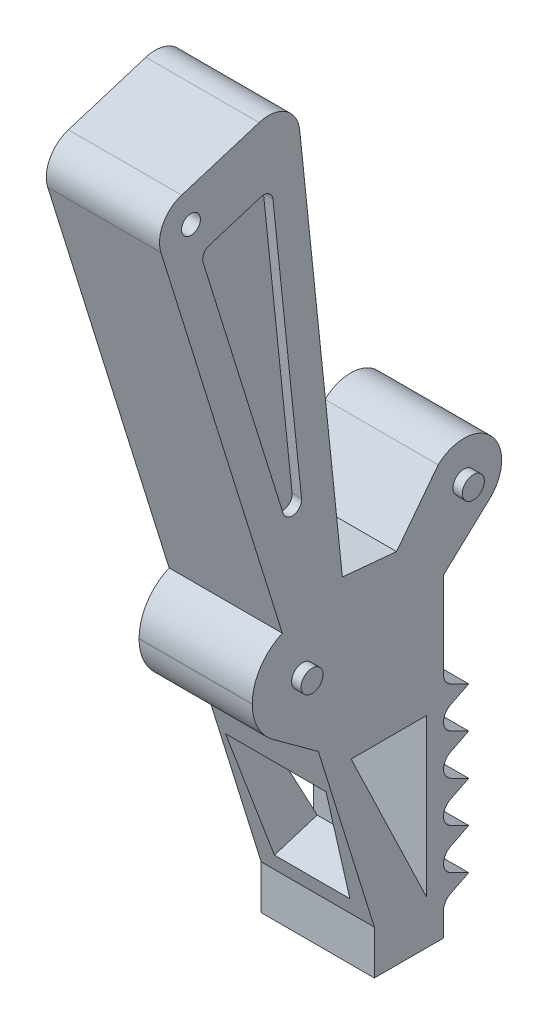
from build123d import *

# Parameters (mm, degrees)
BOSS_EXTRUDE1_DEPTH    = 9
CUT_EXTRUDE1_DEPTH     = 25
BOSS_EXTRUDE2_DEPTH    = 18
FILLET1_R              = 2
LPATTERN1_COUNT        = 5
LPATTERN1_PITCH        = 6.5
FILLET1_OF_LPATTERN1_R = 2
FILLET2_R              = 8
FILLET3_R              = 5
SKETCH4_R              = 1.5
CUT_EXTRUDE2_DEPTH     = 25
CUT_EXTRUDE3_DEPTH     = 8
SKETCH6_R              = 1.75
BOSS_EXTRUDE3_DEPTH    = 1.5
SKETCH7_R              = 1.75
BOSS_EXTRUDE4_DEPTH    = 1.5
CUT_EXTRUDE4_DEPTH     = 1.5


with BuildPart() as part:
    # Sketch1 → Boss-Extrude1 (new, symmetric)
    with BuildSketch(Plane(origin=(0, 0, 0), x_dir=(0, 0, -1), z_dir=(1, 0, 0))):
        Polygon((78.599259113, -4.792439116), (85.922516335, 2.017105925), (77.751062285, 10.805014591), (71.129492545, 2.15772468), (62.512029777, 2.969258034), (52.963024241, 0), (48.188521473, -1.484629017), (48.188521473, -11.484629017), (58.691485012, -19.145422508), (67.599259113, -47.792439116), (67.599259113, -54.792439116), (78.599259113, -54.792439116), align=None)
        Polygon((62.512029777, 2.969258034), (52.963024241, 0), (32.178218004, 66.843038752), (55.09583129, 73.969258034), align=None)
        with BuildLine():
            Line((85.922516335, 2.017105925), (77.751062285, 10.805014591))
            ThreePointArc((77.751062285, 10.805014591), (86.230743643, 10.496787283), (85.922516335, 2.017105925))
        make_face()
    extrude(amount=BOSS_EXTRUDE1_DEPTH, both=True)

    # Sketch2 → Cut-Extrude1 (cut)
    with BuildSketch(Plane(origin=(9, 0, 0), x_dir=(0, 0, -1), z_dir=(1, 0, 0))):
        Polygon((75.899259113, -47.792439116), (75.899259113, -22.792439116), (63.899259113, -22.792439116), align=None)
    extrude(amount=-CUT_EXTRUDE1_DEPTH, mode=Mode.SUBTRACT)

    # Sketch3 → Boss-Extrude2 (add)
    with BuildSketch(Plane(origin=(9, 0, 0), x_dir=(0, 0, -1), z_dir=(1, 0, 0))):
        Polygon((78.599259113, -47.792439116), (78.599259113, -49.792439116), (82.599259113, -47.792439116), align=None)
        Polygon((78.599259113, -45.792439116), (78.599259113, -47.792439116), (82.599259113, -47.792439116), align=None)
    boss_extrude2 = extrude(amount=-BOSS_EXTRUDE2_DEPTH)

    # Fillet1
    fillet1_edges = [part.edges().sort_by_distance(p)[0] for p in [
        (0, -49.792439116, -78.599259113),
        (0, -45.792439116, -78.599259113),
    ]]
    fillet(fillet1_edges, radius=FILLET1_R)

    # LPattern1: Boss-Extrude2 ×5
    with Locations(*[(0, i * LPATTERN1_PITCH, 0) for i in range(1, LPATTERN1_COUNT)]):
        add(boss_extrude2)

    # Fillet1 of LPattern1
    fillet1_of_lpattern1_edges = [part.edges().sort_by_distance(p)[0] for p in [
        (0, -43.292439116, -78.599259113),
        (0, -39.292439116, -78.599259113),
        (0, -36.792439116, -78.599259113),
        (0, -32.792439116, -78.599259113),
        (0, -30.292439116, -78.599259113),
        (0, -26.292439116, -78.599259113),
        (0, -23.792439116, -78.599259113),
        (0, -19.792439116, -78.599259113),
    ]]
    fillet(fillet1_of_lpattern1_edges, radius=FILLET1_OF_LPATTERN1_R)

    # Fillet2
    # the kernel refuses this fillet: 8 mm, written as the material it takes off along each edge
    with BuildSketch(Plane(origin=(-19.167047595, -11.484629017, -48.188521473), x_dir=(0, -0.5892918069975562, -0.8079202721838058), z_dir=(1, 0, 0))) as fillet2_piece_1:
        with BuildLine():
            CenterArc((FILLET2_R * 0.508352379737, FILLET2_R), FILLET2_R, 216.10676877, 53.89323123)
            Line((-FILLET2_R * 0.299567892447, FILLET2_R * 0.410708193002), (-FILLET2_R * 0.31572629789, FILLET2_R * 0.398922356862))
            Line((-FILLET2_R * 0.31572629789, FILLET2_R * 0.398922356862), (-FILLET2_R * 0.0101670475947, -FILLET2_R * 0.02))
            Line((-FILLET2_R * 0.0101670475947, -FILLET2_R * 0.02), (FILLET2_R * 0.508352379737, -FILLET2_R * 0.02))
            Line((FILLET2_R * 0.508352379737, -FILLET2_R * 0.02), (FILLET2_R * 0.508352379737, 0))
        make_face()
    extrude(amount=38.334095189, mode=Mode.SUBTRACT)
    with BuildSketch(Plane(origin=(-23.590778332, -1.484629017, -48.188521473), x_dir=(0, -1, 0), z_dir=(1, 0, 0))) as fillet2_piece_2:
        with BuildLine():
            CenterArc((5.836311333, 8), FILLET2_R, 203.777574667, 66.222425333)
            Line((-1.484629017, 4.774502768), (-1.631047824, 4.709992823))
            ThreePointArc((-1.631047824, 4.709992823), (-0.895098597, 2.339743255), (-0.152784089, -0.047508129))
            Line((-0.152784089, -0.047508129), (0, -0.16))
            Line((0, -0.16), (5.836311333, -0.16))
            Line((5.836311333, -0.16), (5.836311333, 0))
        make_face()
    extrude(amount=47.181556665, mode=Mode.SUBTRACT)

    # Fillet3
    fillet3_edges = [part.edges().sort_by_distance(p)[0] for p in [
        (0, 66.843038752, -32.178218004),
        (0, 73.969258034, -55.09583129),
    ]]
    fillet(fillet3_edges, radius=FILLET3_R)

    # Sketch4 → Cut-Extrude2 (cut)
    with BuildSketch(Plane(origin=(9, 0, 0), x_dir=(0, 0, -1), z_dir=(1, 0, 0))):
        with Locations((38.437349789, 63.553165001)):
            Circle(SKETCH4_R)
    extrude(amount=-CUT_EXTRUDE2_DEPTH, mode=Mode.SUBTRACT)

    # Sketch5 → Cut-Extrude3 (cut)
    with BuildSketch(Plane(origin=(0, 14.953112663, -48.088564203), x_dir=(1, 0, 0), z_dir=(0, -0.29692580339417163, 0.95490055360688))):
        Polygon((-8, -43.208990891), (8, -43.208990891), (6, -62.708990891), (-6, -62.708990891), align=None)
    extrude(amount=-CUT_EXTRUDE3_DEPTH, mode=Mode.SUBTRACT)

    # Sketch6 → Boss-Extrude3 (add)
    with BuildSketch(Plane(origin=(9, 0, 0), x_dir=(0, 0, -1), z_dir=(1, 0, 0))):
        with Locations((81.83678931, 6.411060258)):
            Circle(SKETCH6_R)
    boss_extrude3 = extrude(amount=BOSS_EXTRUDE3_DEPTH)

    # Sketch7 → Boss-Extrude4 (add)
    with BuildSketch(Plane(origin=(9, 0, 0), x_dir=(0, 0, -1), z_dir=(1, 0, 0))):
        with Locations((56.188521473, -7.417809979)):
            Circle(SKETCH7_R)
    boss_extrude4 = extrude(amount=BOSS_EXTRUDE4_DEPTH)

    # Sketch8 → Cut-Extrude4 (cut)
    with BuildSketch(Plane(origin=(9, 0, 0), x_dir=(0, 0, -1), z_dir=(1, 0, 0))):
        with BuildLine():
            Line((41.354329636, 59.224050938), (49.539044528, 61.769083545))
            ThreePointArc((49.539044528, 61.769083545), (50.809758993, 61.589265105), (51.476316689, 60.492565163))
            Line((51.476316689, 60.492565163), (56.016764829, 17.023958099))
            ThreePointArc((56.016764829, 17.023958099), (54.826962078, 15.398858062), (53.092530542, 16.422736945))
            Line((53.092530542, 16.422736945), (40.367367511, 57.346311403))
            ThreePointArc((40.367367511, 57.346311403), (40.471955982, 58.48958772), (41.354329636, 59.224050938))
        make_face()
    cut_extrude4 = extrude(amount=-CUT_EXTRUDE4_DEPTH, mode=Mode.SUBTRACT)

    # Mirror1: Boss-Extrude3, Boss-Extrude4, Cut-Extrude4 across plane
    add(boss_extrude3.mirror(Plane(origin=(0, 0, 0), x_dir=(0, 0, 1), z_dir=(1, 0, 0))))
    add(boss_extrude4.mirror(Plane(origin=(0, 0, 0), x_dir=(0, 0, 1), z_dir=(1, 0, 0))))
    add(cut_extrude4.mirror(Plane(origin=(0, 0, 0), x_dir=(0, 0, 1), z_dir=(1, 0, 0))), mode=Mode.SUBTRACT)


solid = part.part
